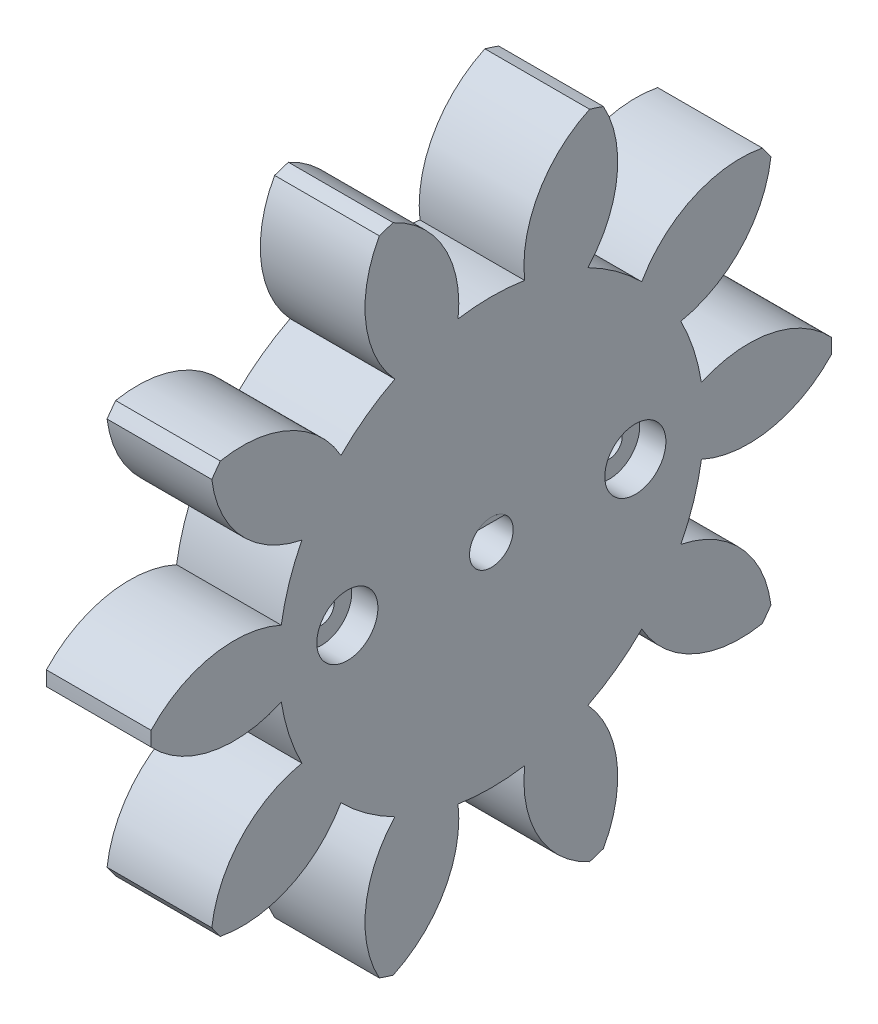
from build123d import *

# Parameters (mm, degrees)
BASPROSKE_W             = 12
BASPROSKE_H             = 39
TOOTHCUT_DEPTH          = 57.444663167
TEETHCUTS_COUNT         = 10
TEETHCUTS_ANGLE         = 324
BORSKE_R                = 1.5
BORE_DEPTH              = 50.0000508
CROQUIS1_R              = 2.5
CORTAR_EXTRUIR1_DEPTH   = 56.31066802
SALIENTE_EXTRUIR1_DEPTH = 12
CROQUIS3_R              = 1.5
CORTAR_EXTRUIR2_DEPTH   = 12
CROQUIS3_3_R            = 3.5
CROQUIS3_3_R_2          = 1.5
CORTAR_EXTRUIR3_DEPTH   = 3


with BuildPart() as part:
    # BasProSke → Base-Revolve (revolve)
    with BuildSketch(Plane(origin=(0, 0, 0), x_dir=(1, 0, 0), z_dir=(0, 1, 0))):
        with Locations((6, 19.5)):
            Rectangle(BASPROSKE_W, BASPROSKE_H)
    revolve(axis=Axis((-10, 0, 0), (1, 0, 0)))

    # TooCutSke → ToothCut (cut, through all)
    with BuildSketch(Plane(origin=(0, 0, 0), x_dir=(0, 0, -1), z_dir=(1, 0, 0))):
        with BuildLine():
            ThreePointArc((3.815775932, 24.073465269), (0, 24.374), (-3.815775932, 24.073465269))
            ThreePointArc((-3.815775932, 24.073465269), (-5.403120307, 31.925375456), (-11.292153099, 37.355978418))
            ThreePointArc((-11.292153099, 37.355978418), (0, 39.0254), (11.292153099, 37.355978418))
            ThreePointArc((11.292153099, 37.355978418), (5.403120307, 31.925375456), (3.815775932, 24.073465269))
        make_face()
    toothcut = extrude(amount=TOOTHCUT_DEPTH, mode=Mode.SUBTRACT)

    # TeethCuts: ToothCut ×10 about axis
    teethcuts_axis = Axis((-10, 0, 0), (1, 0, 0))
    for i in range(1, TEETHCUTS_COUNT):
        add(toothcut.rotate(teethcuts_axis, i * TEETHCUTS_ANGLE / (TEETHCUTS_COUNT - 1)), mode=Mode.SUBTRACT)

    # BorSke → Bore (cut, symmetric)
    with BuildSketch(Plane(origin=(0, 0, 0), x_dir=(0, 0, -1), z_dir=(1, 0, 0))):
        Circle(BORSKE_R)
    extrude(amount=BORE_DEPTH, both=True, mode=Mode.SUBTRACT)

    # Croquis1 → Cortar-Extruir1 (cut, through all)
    with BuildSketch(Plane.YZ.offset(12)):
        Circle(CROQUIS1_R)
    extrude(amount=-CORTAR_EXTRUIR1_DEPTH, mode=Mode.SUBTRACT)

    # Croquis3 → Cortar-Extruir2 (cut)
    with BuildSketch(Plane(origin=(12, 0, 0), x_dir=(0, 0, -1), z_dir=(1, 0, 0))):
        with Locations((-16.5, 0)):
            Circle(CROQUIS3_R)
    cortar_extruir2 = extrude(amount=-CORTAR_EXTRUIR2_DEPTH, mode=Mode.SUBTRACT)

    # Croquis3<3> → Cortar-Extruir3 (cut)
    with BuildSketch(Plane(origin=(12, 0, 0), x_dir=(0, 0, -1), z_dir=(1, 0, 0))):
        with Locations((-16.5, 0)):
            Circle(CROQUIS3_3_R)
        with Locations((-16.5, 0)):
            Circle(CROQUIS3_3_R_2, mode=Mode.SUBTRACT)
    cortar_extruir3 = extrude(amount=-CORTAR_EXTRUIR3_DEPTH, mode=Mode.SUBTRACT)

    # Simetría1: Cortar-Extruir2, Cortar-Extruir3 across plane
    add(cortar_extruir2.mirror(Plane.XY), mode=Mode.SUBTRACT)
    add(cortar_extruir3.mirror(Plane.XY), mode=Mode.SUBTRACT)


with BuildPart() as body_2:
    # Croquis2 → Saliente-Extruir1 (new body)
    with BuildSketch(Plane(origin=(12, 0, 0), x_dir=(0, 0, -1), z_dir=(1, 0, 0))):
        with BuildLine():
            ThreePointArc((1.564448785, 1.95), (0, 2.5), (-1.564448785, 1.95))
            Line((-1.564448785, 1.95), (1.564448785, 1.95))
        make_face()
    extrude(amount=-SALIENTE_EXTRUIR1_DEPTH)


solid = Compound([part.part, body_2.part])
